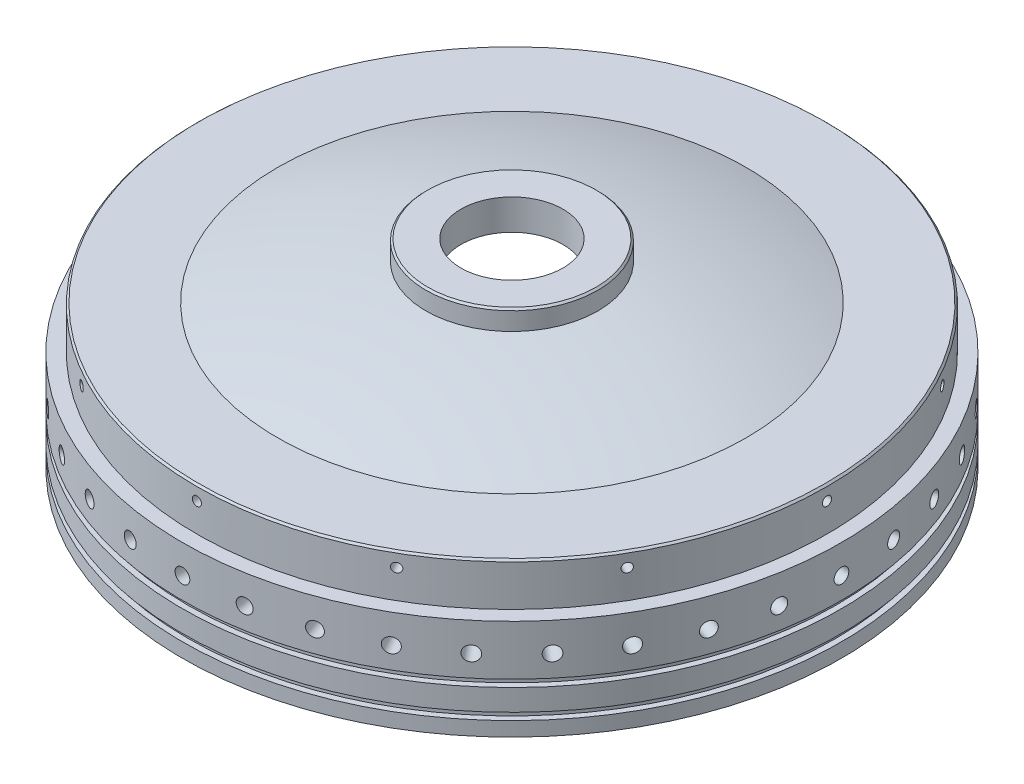
from build123d import *

# Parameters (mm, degrees)
SKETCH2_R                       = 38.1
BOSS_EXTRUDE1_DEPTH             = 6.35
BOSS_EXTRUDE1_DIRECTION_2_REACH = 224.127
CIRPATTERN1_COUNT               = 36
F_2_4_5_TAPPED_HOLE1_D          = 45.24248
F_2_4_5_TAPPED_HOLE1_DEPTH      = 118.618
F_2_4_5_TAPPED_HOLE1_TIP        = 13.59221227
CHAMFER2_SIZE                   = 0.79375
CIRPATTERN2_COUNT               = 12


with BuildPart() as part:
    # Sketch1 → Revolve1 (revolve)
    with BuildSketch(Plane.XY):
        with BuildLine():
            Line((0, 81.727348484), (0, 75.377348484))
            ThreePointArc((0, 75.377348484), (67.208178416, 67.540379415), (130.81, 44.45))
            Line((130.81, 44.45), (130.81, 22.225))
            Line((130.81, 22.225), (136.525, 22.225))
            Line((136.525, 22.225), (136.525, 0))
            Line((136.525, 0), (146.05, 0))
            Line((146.05, 0), (146.05, 6.35))
            Line((146.05, 6.35), (143.51, 6.35))
            Line((143.51, 6.35), (143.51, 9.525))
            Line((143.51, 9.525), (146.05, 9.525))
            Line((146.05, 9.525), (146.05, 19.05))
            Line((146.05, 19.05), (143.51, 19.05))
            Line((143.51, 19.05), (143.51, 22.225))
            Line((143.51, 22.225), (146.05, 22.225))
            Line((146.05, 22.225), (146.05, 44.45))
            Line((146.05, 44.45), (139.622896369, 44.45))
            Line((139.622896369, 44.45), (139.622896369, 63.5))
            Line((139.622896369, 63.5), (103.822711403, 63.5))
            ThreePointArc((103.822711403, 63.5), (52.705292988, 77.135929459), (0, 81.727348484))
        make_face()
    revolve(axis=Axis((0, 81.727348484, 0), (0, -1, 0)))

    # Sketch2 → Boss-Extrude1 (add)
    with BuildSketch(Plane(origin=(0, 81.727348484, 0), x_dir=(1, 0, 0), z_dir=(0, 1, 0))):
        Circle(SKETCH2_R)
    extrude(amount=BOSS_EXTRUDE1_DEPTH)

    # Sketch2 → Boss-Extrude1 direction 2 (add, up to next)
    with BuildSketch(Plane(origin=(0, 81.727348484, 0), x_dir=(1, 0, 0), z_dir=(0, 1, 0)), mode=Mode.PRIVATE) as boss_extrude1_direction_2_sk1:
        Circle(SKETCH2_R)
    boss_extrude1_direction_2_tool1 = extrude(boss_extrude1_direction_2_sk1.sketch, amount=-BOSS_EXTRUDE1_DIRECTION_2_REACH, mode=Mode.PRIVATE) - part.part
    add(boss_extrude1_direction_2_tool1.solids().sort_by_distance((0, 81.727348, 0))[0])

    # Sketch5 → 5/16-18 Tapped Hole1 (revolve, cut)
    with BuildSketch(Plane(origin=(-146.05, 31.75, 0), x_dir=(0, 0, 1), z_dir=(0, 1, 0))):
        Polygon((0, 0), (0, 14.661148974), (3.2639, 12.7), (3.2639, 0), align=None)
    f_5_16_18_tapped_hole1 = revolve(axis=Axis((-152.4, 31.75, 0), (1, 0, 0)), mode=Mode.SUBTRACT)

    # CirPattern1: 5/16-18 Tapped Hole1 ×36 about axis
    cirpattern1_axis = Axis((0, 44.45, 0), (0, 1, 0))
    for i in range(1, CIRPATTERN1_COUNT):
        add(f_5_16_18_tapped_hole1.rotate(cirpattern1_axis, i * 360 / CIRPATTERN1_COUNT), mode=Mode.SUBTRACT)

    # Sketch7 → #10-32 Tapped Hole1 (revolve, cut)
    with BuildSketch(Plane(origin=(-139.622896369, 57.15, 0), x_dir=(0, 0, 1), z_dir=(0, 1, 0))):
        Polygon((0, 0), (0, 13.151317848), (2.0193, 11.938), (2.0193, 0), align=None)
    f_10_32_tapped_hole1 = revolve(axis=Axis((-145.972896369, 57.15, 0), (1, 0, 0)), mode=Mode.SUBTRACT)

    # 2-4.5 Tapped Hole1
    with Locations(Plane(origin=(0, 88.077348484, 0), x_dir=(1, 0, 0), z_dir=(0, 1, 0))):
        with Locations((0, 0)):
            Hole(F_2_4_5_TAPPED_HOLE1_D / 2, depth=F_2_4_5_TAPPED_HOLE1_DEPTH)
            with Locations((0, 0, -(F_2_4_5_TAPPED_HOLE1_DEPTH + F_2_4_5_TAPPED_HOLE1_TIP / 2))):  # 118° drill point
                Cone(0, F_2_4_5_TAPPED_HOLE1_D / 2, F_2_4_5_TAPPED_HOLE1_TIP, mode=Mode.SUBTRACT)

    # Chamfer2
    chamfer2_edges = [part.edges().sort_by_distance(p)[0] for p in [
        (-38.1, 88.077348484, 0),
        (-139.622896369, 63.5, 0),
    ]]
    chamfer(chamfer2_edges, length=CHAMFER2_SIZE)

    # CirPattern2: #10-32 Tapped Hole1 ×12 about axis
    cirpattern2_axis = Axis((0, 63.5, 0), (0, 1, 0))
    for i in range(1, CIRPATTERN2_COUNT):
        add(f_10_32_tapped_hole1.rotate(cirpattern2_axis, i * 360 / CIRPATTERN2_COUNT), mode=Mode.SUBTRACT)


solid = part.part
